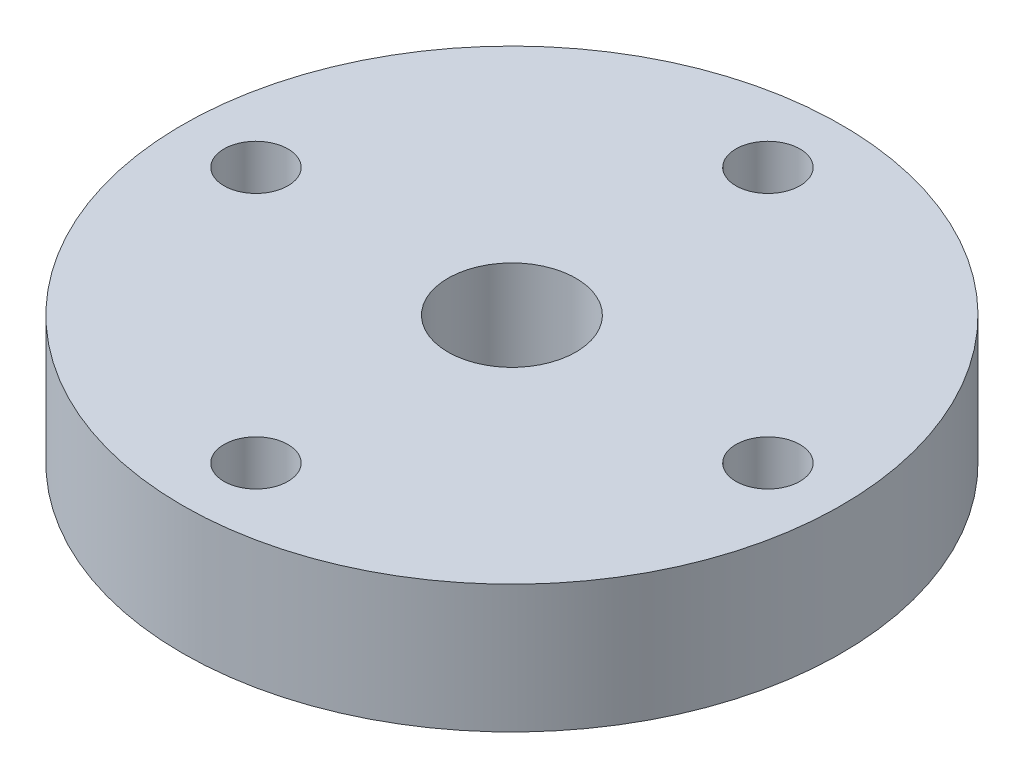
from build123d import *

# Parameters (mm, degrees)
SKETCH1_R           = 10.3
SKETCH1_R_2         = 2
BOSS_EXTRUDE1_DEPTH = 4
SKETCH2_R           = 1
CUT_EXTRUDE1_DEPTH  = 4
SKETCH3_R           = 6
SKETCH3_R_2         = 4.25
CUT_EXTRUDE2_DEPTH  = 2


with BuildPart() as part:
    # Sketch1 → Boss-Extrude1 (new body)
    with BuildSketch(Plane(origin=(0, 0, 0), x_dir=(1, 0, 0), z_dir=(0, 1, 0))):
        Circle(SKETCH1_R)
        Circle(SKETCH1_R_2, mode=Mode.SUBTRACT)
    extrude(amount=BOSS_EXTRUDE1_DEPTH)

    # Sketch2 → Cut-Extrude1 (cut)
    with BuildSketch(Plane(origin=(0, 4, 0), x_dir=(-1, 0, 0), z_dir=(0, 1, 0))):
        with Locations((0, -8)):
            Circle(SKETCH2_R)
        with Locations((8, 0)):
            Circle(SKETCH2_R)
        with Locations((-8, 0)):
            Circle(SKETCH2_R)
        with Locations((0, 8)):
            Circle(SKETCH2_R)
    extrude(amount=-CUT_EXTRUDE1_DEPTH, mode=Mode.SUBTRACT)

    # Sketch3 → Cut-Extrude2 (cut)
    with BuildSketch(Plane.XZ):
        Circle(SKETCH3_R)
        Circle(SKETCH3_R_2, mode=Mode.SUBTRACT)
    extrude(amount=-CUT_EXTRUDE2_DEPTH, mode=Mode.SUBTRACT)


solid = part.part
